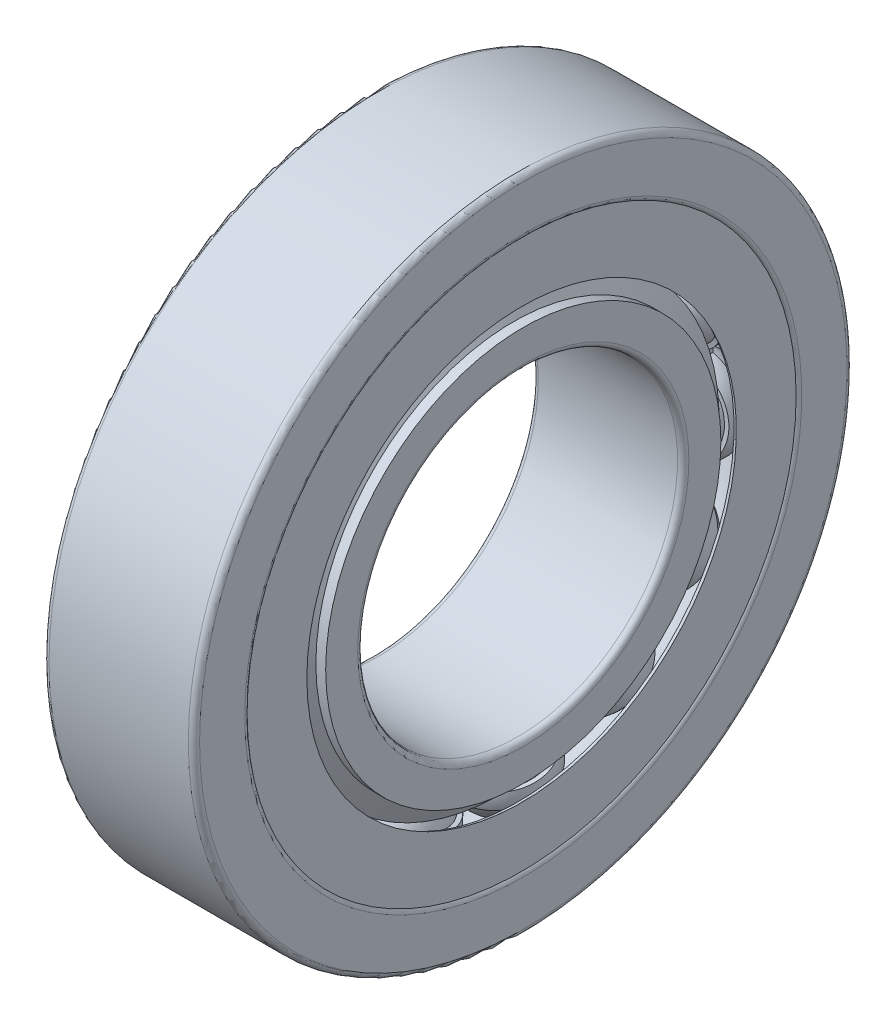
from build123d import *

# Parameters (mm, degrees)
SKETCH_5_W               = 1.3499999999999999
SKETCH_5_H               = 0.8999999999999986
PATTERN_CIRCULAR_5_COUNT = 15
PATTERN_CIRCULAR_2_COUNT = 15


with BuildPart() as part:
    # 草图2 → 旋转1 (revolve)
    with BuildSketch(Plane.XY):
        with BuildLine():
            Line((2.8999999999999986, 11.500000000000002), (3.4773502691896216, 10.500000000000002))
            Line((3.4773502691896216, 10.500000000000002), (3.9999999999999982, 10.500000000000002))
            Line((3.9999999999999982, 10.500000000000002), (3.999999999999999, 8.800000000000006))
            ThreePointArc((3.999999999999999, 8.800000000000006), (3.9121320343559645, 8.58786796564404), (3.6999999999999984, 8.500000000000004))
            Line((3.6999999999999984, 8.500000000000004), (-3.7000000000000006, 8.500000000000005))
            ThreePointArc((-3.7000000000000006, 8.500000000000005), (-3.912132034355965, 8.587867965644042), (-4.000000000000001, 8.800000000000006))
            Line((-4.000000000000001, 8.800000000000006), (-3.9999999999999982, 10.5))
            Line((-3.9999999999999982, 10.5), (-3.4773502691896216, 10.500000000000002))
            Line((-3.4773502691896216, 10.500000000000002), (-2.8999999999999986, 11.500000000000002))
            Line((-2.8999999999999986, 11.500000000000002), (-1.677050983124848, 11.5))
            ThreePointArc((-1.677050983124848, 11.5), (3.2e-16, 10.749999999999995), (1.677050983124848, 11.5))
            Line((1.677050983124848, 11.5), (2.8999999999999986, 11.500000000000002))
        make_face()
        with BuildLine():
            Line((-4.000000000000003, 17.2), (-4.000000000000002, 14.800000000000002))
            ThreePointArc((-4.000000000000002, 14.800000000000002), (-3.9121320343559662, 14.587867965644039), (-3.700000000000002, 14.500000000000002))
            Line((-3.700000000000002, 14.500000000000002), (-1.6770509831248428, 14.500000000000004))
            ThreePointArc((-1.6770509831248428, 14.500000000000004), (-1.8e-16, 15.250000000000002), (1.6770509831248424, 14.500000000000004))
            Line((1.6770509831248424, 14.500000000000004), (3.7000000000000064, 14.500000000000005))
            ThreePointArc((3.7000000000000064, 14.500000000000005), (3.9121320343559756, 14.587867965644042), (4.000000000000015, 14.80000000000001))
            Line((4.000000000000015, 14.80000000000001), (3.999999999999999, 17.2))
            ThreePointArc((3.999999999999999, 17.2), (3.912132034355963, 17.412132034355963), (3.6999999999999984, 17.5))
            Line((3.6999999999999984, 17.5), (-3.700000000000002, 17.5))
            ThreePointArc((-3.700000000000002, 17.5), (-3.9121320343559667, 17.412132034355963), (-4.000000000000003, 17.2))
        make_face()
    revolve(axis=Axis((-3.4999999999999996, 0, 0), (1, 0, 0)))


with BuildPart() as body_2:
    # 草图5 → 旋转3 (revolve)
    with BuildSketch(Plane.XY):
        with Locations((6.7e-16, 13)):
            Rectangle(SKETCH_5_W, SKETCH_5_H)
    revolve(axis=Axis((-19.927092192426834, 0, 0), (1, 0, 0)))



with BuildPart() as body_3:
    # 草图3 → 旋转2 (revolve)
    with BuildSketch(Plane.XY):
        with BuildLine():
            ThreePointArc((2.474999999999998, 13), (-7e-17, 15.474999999999998), (-2.4749999999999988, 13))
            Line((-2.4749999999999988, 13), (2.4749999999999988, 13))
        make_face()
    revolve(axis=Axis((-2.4749999999999988, 13, 0), (1, 0, 0)))


with BuildPart() as pattern_circular_5_1:
    # 阵列(圆周)5: pattern copy
    add(body_3.part.rotate(Axis((-3.8500000000000054, 0, 0), (1, 0, 0)), 1 * 360 / PATTERN_CIRCULAR_5_COUNT))


with BuildPart() as pattern_circular_5_2:
    # 阵列(圆周)5: pattern copy
    add(body_3.part.rotate(Axis((-3.8500000000000054, 0, 0), (1, 0, 0)), 2 * 360 / PATTERN_CIRCULAR_5_COUNT))


with BuildPart() as pattern_circular_5_3:
    # 阵列(圆周)5: pattern copy
    add(body_3.part.rotate(Axis((-3.8500000000000054, 0, 0), (1, 0, 0)), 3 * 360 / PATTERN_CIRCULAR_5_COUNT))


with BuildPart() as pattern_circular_5_4:
    # 阵列(圆周)5: pattern copy
    add(body_3.part.rotate(Axis((-3.8500000000000054, 0, 0), (1, 0, 0)), 4 * 360 / PATTERN_CIRCULAR_5_COUNT))


with BuildPart() as pattern_circular_5_5:
    # 阵列(圆周)5: pattern copy
    add(body_3.part.rotate(Axis((-3.8500000000000054, 0, 0), (1, 0, 0)), 5 * 360 / PATTERN_CIRCULAR_5_COUNT))


with BuildPart() as pattern_circular_5_6:
    # 阵列(圆周)5: pattern copy
    add(body_3.part.rotate(Axis((-3.8500000000000054, 0, 0), (1, 0, 0)), 6 * 360 / PATTERN_CIRCULAR_5_COUNT))


with BuildPart() as pattern_circular_5_7:
    # 阵列(圆周)5: pattern copy
    add(body_3.part.rotate(Axis((-3.8500000000000054, 0, 0), (1, 0, 0)), 7 * 360 / PATTERN_CIRCULAR_5_COUNT))


with BuildPart() as pattern_circular_5_8:
    # 阵列(圆周)5: pattern copy
    add(body_3.part.rotate(Axis((-3.8500000000000054, 0, 0), (1, 0, 0)), 8 * 360 / PATTERN_CIRCULAR_5_COUNT))


with BuildPart() as pattern_circular_5_9:
    # 阵列(圆周)5: pattern copy
    add(body_3.part.rotate(Axis((-3.8500000000000054, 0, 0), (1, 0, 0)), 9 * 360 / PATTERN_CIRCULAR_5_COUNT))


with BuildPart() as pattern_circular_5_10:
    # 阵列(圆周)5: pattern copy
    add(body_3.part.rotate(Axis((-3.8500000000000054, 0, 0), (1, 0, 0)), 10 * 360 / PATTERN_CIRCULAR_5_COUNT))


with BuildPart() as pattern_circular_5_11:
    # 阵列(圆周)5: pattern copy
    add(body_3.part.rotate(Axis((-3.8500000000000054, 0, 0), (1, 0, 0)), 11 * 360 / PATTERN_CIRCULAR_5_COUNT))


with BuildPart() as pattern_circular_5_12:
    # 阵列(圆周)5: pattern copy
    add(body_3.part.rotate(Axis((-3.8500000000000054, 0, 0), (1, 0, 0)), 12 * 360 / PATTERN_CIRCULAR_5_COUNT))


with BuildPart() as pattern_circular_5_13:
    # 阵列(圆周)5: pattern copy
    add(body_3.part.rotate(Axis((-3.8500000000000054, 0, 0), (1, 0, 0)), 13 * 360 / PATTERN_CIRCULAR_5_COUNT))


with BuildPart() as pattern_circular_5_14:
    # 阵列(圆周)5: pattern copy
    add(body_3.part.rotate(Axis((-3.8500000000000054, 0, 0), (1, 0, 0)), 14 * 360 / PATTERN_CIRCULAR_5_COUNT))


with BuildPart() as cut_revolve_1_tool:
    # 草图6 → 切除-旋转1 (revolve)
    with BuildSketch(Plane.XY):
        with BuildLine():
            Line((-2.433747110938192, 13.45), (2.433747110938192, 13.45))
            ThreePointArc((2.433747110938192, 13.45), (2.9e-16, 15.474999999999998), (-2.433747110938192, 13.45))
        make_face()
        with BuildLine():
            Line((-2.433747110938192, 12.549999999999999), (2.433747110938192, 12.549999999999999))
            ThreePointArc((2.433747110938192, 12.549999999999999), (2.9e-16, 10.525), (-2.433747110938192, 12.549999999999999))
        make_face()
    revolve(axis=Axis((-19.927092192426834, 0, 0), (1, 0, 0)))


with BuildPart() as part_1:
    add(part.part)

    # 切除-旋转1: cut by cut_revolve_1_tool
    add(cut_revolve_1_tool.part, mode=Mode.SUBTRACT)

    # 草图9 → 旋转5 (revolve)
    with BuildSketch(Plane.XY):
        with BuildLine():
            Line((3.7000000000000064, 14.500000000000005), (3.700000000000003, 11.499999999999996))
            ThreePointArc((3.700000000000003, 11.499999999999996), (3.814805029709531, 11.477163859753395), (3.9121320343559707, 11.412132034355974))
            Line((3.9121320343559707, 11.412132034355974), (3.9121320343559742, 14.58786796564404))
            ThreePointArc((3.9121320343559742, 14.58786796564404), (3.8148050297095346, 14.52283614024662), (3.7000000000000064, 14.500000000000005))
        make_face()
        with BuildLine():
            Line((-3.9121320343559742, 14.58786796564404), (-3.9121320343559707, 11.412132034355972))
            ThreePointArc((-3.9121320343559707, 11.412132034355972), (-3.8148050297095306, 11.477163859753393), (-3.700000000000002, 11.499999999999995))
            Line((-3.700000000000002, 11.499999999999995), (-3.7000000000000064, 14.500000000000004))
            ThreePointArc((-3.7000000000000064, 14.500000000000004), (-3.8148050297095355, 14.522836140246618), (-3.9121320343559742, 14.58786796564404))
        make_face()
    revolve(axis=Axis((-19.927092192426834, 0, 0), (1, 0, 0)))


with BuildPart() as body_3_1:
    add(body_3.part)

    # 切除-旋转1: cut by cut_revolve_1_tool
    add(cut_revolve_1_tool.part, mode=Mode.SUBTRACT)


with BuildPart() as pattern_circular_5_1_1:
    add(pattern_circular_5_1.part)

    # 切除-旋转1: cut by cut_revolve_1_tool
    add(cut_revolve_1_tool.part, mode=Mode.SUBTRACT)


with BuildPart() as pattern_circular_5_2_1:
    add(pattern_circular_5_2.part)

    # 切除-旋转1: cut by cut_revolve_1_tool
    add(cut_revolve_1_tool.part, mode=Mode.SUBTRACT)


with BuildPart() as pattern_circular_5_3_1:
    add(pattern_circular_5_3.part)

    # 切除-旋转1: cut by cut_revolve_1_tool
    add(cut_revolve_1_tool.part, mode=Mode.SUBTRACT)


with BuildPart() as pattern_circular_5_4_1:
    add(pattern_circular_5_4.part)

    # 切除-旋转1: cut by cut_revolve_1_tool
    add(cut_revolve_1_tool.part, mode=Mode.SUBTRACT)


with BuildPart() as pattern_circular_5_5_1:
    add(pattern_circular_5_5.part)

    # 切除-旋转1: cut by cut_revolve_1_tool
    add(cut_revolve_1_tool.part, mode=Mode.SUBTRACT)


with BuildPart() as pattern_circular_5_6_1:
    add(pattern_circular_5_6.part)

    # 切除-旋转1: cut by cut_revolve_1_tool
    add(cut_revolve_1_tool.part, mode=Mode.SUBTRACT)


with BuildPart() as pattern_circular_5_7_1:
    add(pattern_circular_5_7.part)

    # 切除-旋转1: cut by cut_revolve_1_tool
    add(cut_revolve_1_tool.part, mode=Mode.SUBTRACT)


with BuildPart() as pattern_circular_5_8_1:
    add(pattern_circular_5_8.part)

    # 切除-旋转1: cut by cut_revolve_1_tool
    add(cut_revolve_1_tool.part, mode=Mode.SUBTRACT)


with BuildPart() as pattern_circular_5_9_1:
    add(pattern_circular_5_9.part)

    # 切除-旋转1: cut by cut_revolve_1_tool
    add(cut_revolve_1_tool.part, mode=Mode.SUBTRACT)


with BuildPart() as pattern_circular_5_10_1:
    add(pattern_circular_5_10.part)

    # 切除-旋转1: cut by cut_revolve_1_tool
    add(cut_revolve_1_tool.part, mode=Mode.SUBTRACT)


with BuildPart() as pattern_circular_5_11_1:
    add(pattern_circular_5_11.part)

    # 切除-旋转1: cut by cut_revolve_1_tool
    add(cut_revolve_1_tool.part, mode=Mode.SUBTRACT)


with BuildPart() as pattern_circular_5_12_1:
    add(pattern_circular_5_12.part)

    # 切除-旋转1: cut by cut_revolve_1_tool
    add(cut_revolve_1_tool.part, mode=Mode.SUBTRACT)


with BuildPart() as pattern_circular_5_13_1:
    add(pattern_circular_5_13.part)

    # 切除-旋转1: cut by cut_revolve_1_tool
    add(cut_revolve_1_tool.part, mode=Mode.SUBTRACT)


with BuildPart() as pattern_circular_5_14_1:
    add(pattern_circular_5_14.part)

    # 切除-旋转1: cut by cut_revolve_1_tool
    add(cut_revolve_1_tool.part, mode=Mode.SUBTRACT)


with BuildPart() as body_2_1:
    add(body_2.part)

    add(body_3_1.part)  # 旋转4 merges body 3
    # 草图7 → 旋转4 (revolve)
    with BuildSketch(Plane.XY):
        with BuildLine():
            Line((-2.2500000000000036, 13), (2.2500000000000036, 13))
            ThreePointArc((2.2500000000000036, 13), (8.2e-16, 15.250000000000004), (-2.2500000000000036, 13))
        make_face()
    revolve_4 = revolve(axis=Axis((-2.2500000000000036, 13, 0), (1, 0, 0)))

    # 阵列(圆周)2: 旋转4 ×15 about axis
    pattern_circular_2_axis = Axis((-3.8500000000000054, 0, 0), (1, 0, 0))
    for i in range(1, PATTERN_CIRCULAR_2_COUNT):
        add(revolve_4.rotate(pattern_circular_2_axis, i * 360 / PATTERN_CIRCULAR_2_COUNT))


solid = Compound([part_1.part, pattern_circular_5_1_1.part, pattern_circular_5_2_1.part, pattern_circular_5_3_1.part, pattern_circular_5_4_1.part, pattern_circular_5_5_1.part, pattern_circular_5_6_1.part, pattern_circular_5_7_1.part, pattern_circular_5_8_1.part, pattern_circular_5_9_1.part, pattern_circular_5_10_1.part, pattern_circular_5_11_1.part, pattern_circular_5_12_1.part, pattern_circular_5_13_1.part, pattern_circular_5_14_1.part, body_2_1.part])
